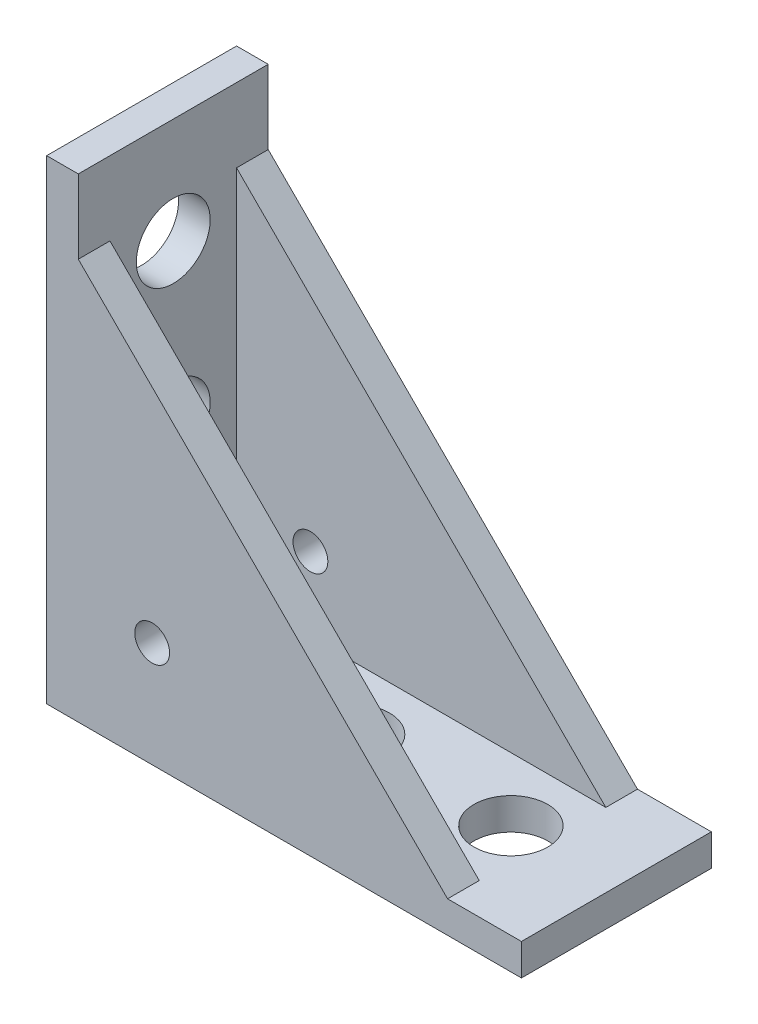
from build123d import *

# Parameters (mm, degrees)
EXTRUDE_1_DEPTH     = 9
SHELL_START         = 3
SHELL_1_OUTLINE_W   = 37
SHELL_1_OUTLINE_H   = 12
SHELL_1_DEPTH       = 35
SKETCH_5_R          = 3.5
CUT_EXTRUDE_1_DEPTH = 63.20932406
SKETCH_6_R          = 3.5
CUT_EXTRUDE_2_DEPTH = 63.20932406
HOLE_WIZARD_M4_1_D  = 3.3


# Read off the part's stored shape, not the designer's step: 抽壳1
with BuildPart() as part:
    # 草图1 → 凸台-拉伸1 (new, symmetric)
    with BuildSketch(Plane.XY):
        Polygon((0, 0), (0, 45), (3, 45), (3, 38), (38, 3), (45, 3), (45, 0), align=None)
    extrude(amount=EXTRUDE_1_DEPTH, both=True)

    # 抽壳1 outline → 抽壳1 (cut)
    with BuildSketch(Plane(origin=(0, 0, 0), x_dir=(1, 0, 0), z_dir=(0, 1, 0)).offset(SHELL_START)):
        with Locations((21.5, 0)):
            Rectangle(SHELL_1_OUTLINE_W, SHELL_1_OUTLINE_H)
    extrude(amount=SHELL_1_DEPTH, mode=Mode.SUBTRACT)

    # 草图5 → 切除-拉伸1 (cut, through all)
    with BuildSketch(Plane(origin=(0, 3, 0), x_dir=(1, 0, 0), z_dir=(0, 1, 0))):
        with Locations(Location((20, 0, 0), (0, 0, 270))):
            Circle(SKETCH_5_R)
        with Locations(Location((35, 0, 0), (0, 0, 270))):
            Circle(SKETCH_5_R)
    extrude(amount=-CUT_EXTRUDE_1_DEPTH, mode=Mode.SUBTRACT)

    # 草图6 → 切除-拉伸2 (cut, through all)
    with BuildSketch(Plane(origin=(3, 0, 0), x_dir=(0, 0, -1), z_dir=(1, 0, 0))):
        with Locations(Location((0, 20, 0), (0, 0, 90))):
            Circle(SKETCH_6_R)
        with Locations(Location((0, 35, 0), (0, 0, 90))):
            Circle(SKETCH_6_R)
    extrude(amount=-CUT_EXTRUDE_2_DEPTH, mode=Mode.SUBTRACT)

    # M4 螺纹孔1 (through all)
    with Locations(Plane(origin=(0, 0, -9), x_dir=(-1, 0, 0), z_dir=(0, 0, -1))):
        with Locations((-10, 10)):
            Hole(HOLE_WIZARD_M4_1_D / 2)


solid = part.part
